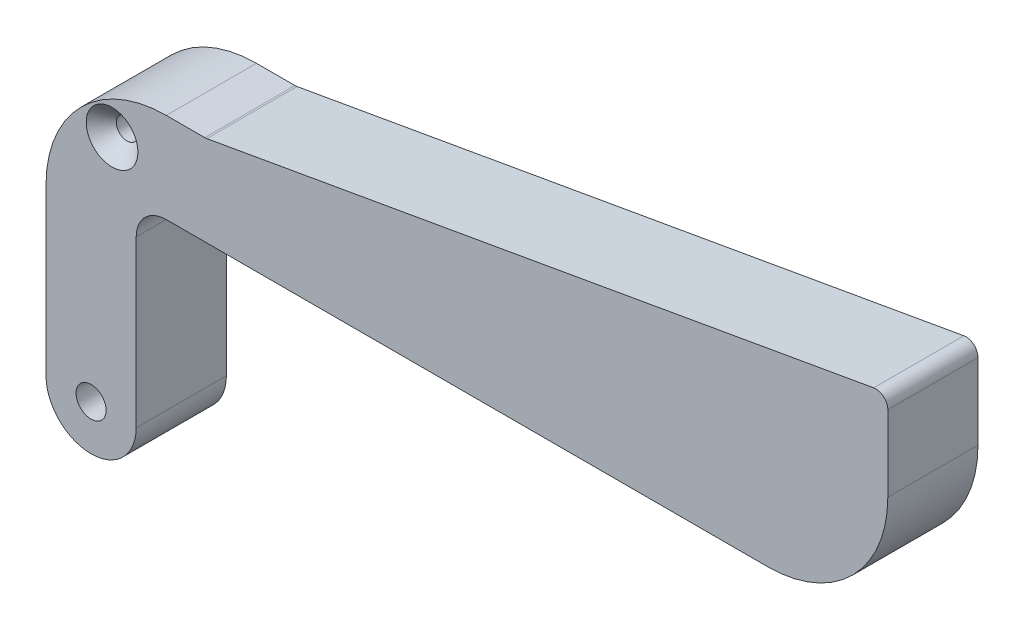
from build123d import *

# Parameters (mm, degrees)
BOSS_EXTRUDE1_DEPTH = 19.05
SKETCH4_W           = 19.05
SKETCH4_H           = 50.8
BOSS_EXTRUDE2_DEPTH = 19.05
FILLET1_R           = 2.54
SKETCH2_R           = 3.175
CUT_EXTRUDE1_DEPTH  = 186.893470837
FILLET2_R           = 25.4
FILLET3_R           = 25.4
FILLET4_R           = 6.35
FILLET5_R           = 9.525
SKETCH6_R           = 2.286
CUT_EXTRUDE3_DEPTH  = 186.893470837
CHAMFER1_SIZE       = 3.175


with BuildPart() as part:
    # Sketch1 → Boss-Extrude1 (new body)
    with BuildSketch(Plane.XY):
        Polygon((0, 0), (177.8, 0), (177.8, 44.45), (33.749441782, 19.05), (0, 19.05), align=None)
    extrude(amount=BOSS_EXTRUDE1_DEPTH)

    # Sketch4 → Boss-Extrude2 (add)
    with BuildSketch(Plane.XY.offset(19.05)):
        with Locations((9.525, -25.4)):
            Rectangle(SKETCH4_W, SKETCH4_H)
    extrude(amount=-BOSS_EXTRUDE2_DEPTH)

    # Fillet1
    fillet1_edges = [part.edges().sort_by_distance(p)[0] for p in [
        (33.749441782, 19.05, 9.525),
        (177.8, 44.45, 9.525),
    ]]
    fillet(fillet1_edges, radius=FILLET1_R)

    # Sketch2 → Cut-Extrude1 (cut, through all)
    with BuildSketch(Plane.XY.offset(19.05)):
        with Locations((9.525, -41.275)):
            Circle(SKETCH2_R)
    extrude(amount=-CUT_EXTRUDE1_DEPTH, mode=Mode.SUBTRACT)

    # Fillet2
    fillet2_edges = [part.edges().sort_by_distance(p)[0] for p in [
        (177.8, 0, 9.525),
    ]]
    fillet(fillet2_edges, radius=FILLET2_R)

    # Fillet3
    fillet3_edges = [part.edges().sort_by_distance(p)[0] for p in [
        (0, 19.05, 9.525),
    ]]
    fillet(fillet3_edges, radius=FILLET3_R)

    # Fillet4
    fillet4_edges = [part.edges().sort_by_distance(p)[0] for p in [
        (19.05, 0, 9.525),
    ]]
    fillet(fillet4_edges, radius=FILLET4_R)

    # Fillet5
    fillet5_edges = [part.edges().sort_by_distance(p)[0] for p in [
        (19.05, -50.8, 9.525),
        (0, -50.8, 9.525),
    ]]
    fillet(fillet5_edges, radius=FILLET5_R - 0.0001)  # a hair under: the kernel refuses the full size

    # Sketch6 → Cut-Extrude3 (cut, through all)
    with BuildSketch(Plane.XY.offset(19.05)):
        with Locations((13.952511732, 9.331690663)):
            Circle(SKETCH6_R)
    extrude(amount=-CUT_EXTRUDE3_DEPTH, mode=Mode.SUBTRACT)

    # Chamfer1
    chamfer1_edges = [part.edges().sort_by_distance(p)[0] for p in [
        (11.666511732, 9.331690663, 19.05),
    ]]
    chamfer(chamfer1_edges, length=CHAMFER1_SIZE)


solid = part.part
